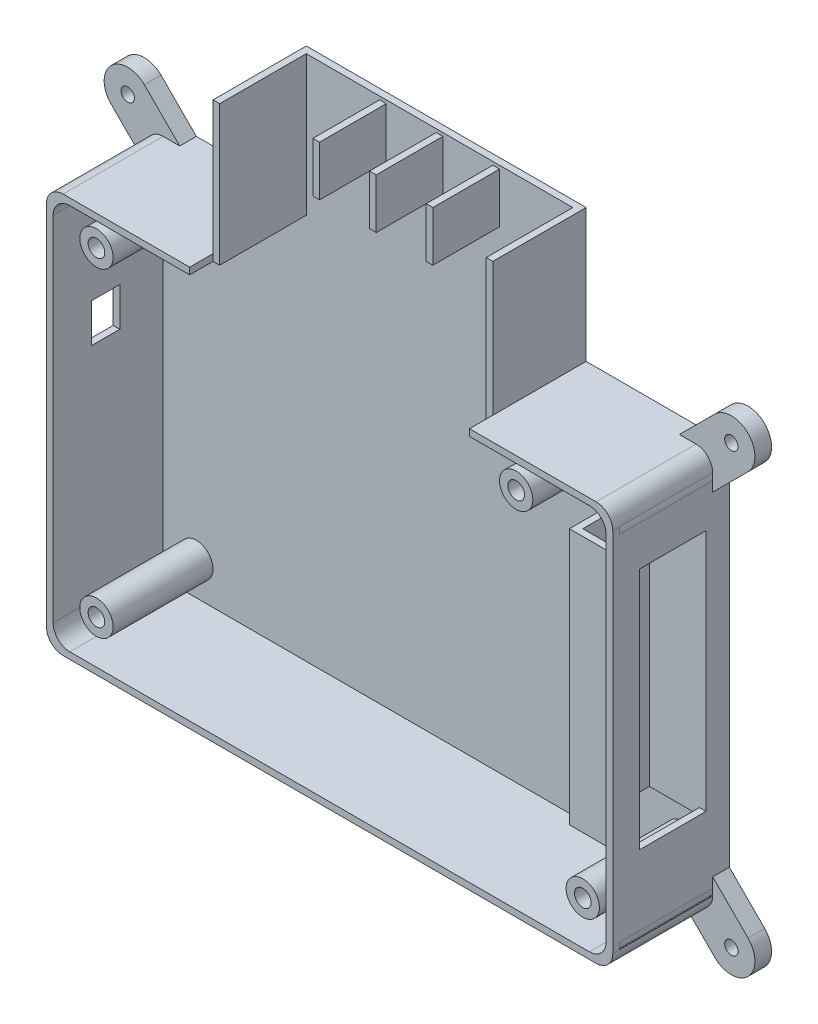
from build123d import *

# Parameters (mm, degrees)
SKETCH1_W                      = 170
SKETCH1_H                      = 120
BOSS_EXTRUDE1_DEPTH            = 35
SHELL1_T                       = -2
SKETCH2_R                      = 2
BOSS_EXTRUDE2_DEPTH            = 5
BOSS_EXTRUDE2_2_DEPTH          = 5
BOSS_EXTRUDE2_3_DEPTH          = 5
BOSS_EXTRUDE2_4_DEPTH          = 5
SKETCH3_W                      = 8.5
SKETCH3_H                      = 11.65
CUT_EXTRUDE1_DEPTH             = 168
SKETCH4_W                      = 84
SKETCH4_H                      = 33
CUT_EXTRUDE2_DEPTH             = 118
FILLET1_R                      = 5
FILLET2_R                      = 5
SKETCH5_W                      = 84
SKETCH5_H                      = 40
BOSS_EXTRUDE3_DEPTH            = 2
FILLET3_R                      = 5
FILLET4_R                      = 5
FILLET5_R                      = 5
FILLET6_R                      = 5
SKETCH9_W                      = 2
SKETCH9_H                      = 15
BOSS_EXTRUDE4_DEPTH            = 20
SKETCH10_W                     = 2
SKETCH10_H                     = 42
BOSS_EXTRUDE5_DEPTH            = 26
SKETCH13_W                     = 24
SKETCH13_H                     = 77
BOSS_EXTRUDE7_DEPTH            = 17
SHELL2_START                   = 7
SHELL2_OUTLINE_W               = 17
SHELL2_OUTLINE_H               = 73
SHELL2_DEPTH                   = 20
SHELL2_START_2                 = 2
SHELL2_2_DEPTH                 = 31
SKETCH14_W                     = 15
SKETCH14_H                     = 20
CUT_EXTRUDE4_DEPTH             = 5
SKETCH15_W                     = 15
SKETCH15_H                     = 20
CUT_EXTRUDE5_DEPTH             = 5
SKETCH21_R                     = 5
BOSS_EXTRUDE8_DEPTH            = 30
F_5_0MM_DOWEL_HOLE2_AT_2_COUNT = 2
F_5_0MM_DOWEL_HOLE2_AT_2_PITCH = 158.404545389


# Read off the part's stored shape, not the designer's step: Shell2
with BuildPart() as part:
    # Sketch1 → Boss-Extrude1 (new body)
    with BuildSketch(Plane.XY):
        with Locations((85, 60)):
            Rectangle(SKETCH1_W, SKETCH1_H)
    extrude(amount=BOSS_EXTRUDE1_DEPTH)

    # Shell1
    shell1_openings = [part.faces().sort_by_distance(p)[0] for p in [
        (85, 60, 35),
    ]]
    offset(amount=SHELL1_T, openings=shell1_openings, kind=Kind.INTERSECTION)

    # Sketch3 → Cut-Extrude1 (cut)
    with BuildSketch(Plane.ZY):
        with Locations((19.25, 79.175)):
            Rectangle(SKETCH3_W, SKETCH3_H)
    extrude(amount=-CUT_EXTRUDE1_DEPTH, mode=Mode.SUBTRACT)

    # Sketch4 → Cut-Extrude2 (cut)
    with BuildSketch(Plane(origin=(0, 120, 0), x_dir=(1, 0, 0), z_dir=(0, 1, 0))):
        with Locations((85, -18.5)):
            Rectangle(SKETCH4_W, SKETCH4_H)
    extrude(amount=-CUT_EXTRUDE2_DEPTH, mode=Mode.SUBTRACT)

    # Fillet1
    fillet1_edges = [part.edges().sort_by_distance(p)[0] for p in [
        (0, 120, 17.5),
        (170, 120, 17.5),
        (170, 0, 17.5),
        (0, 0, 17.5),
    ]]
    fillet(fillet1_edges, radius=FILLET1_R)

    # Fillet2
    fillet2_edges = [part.edges().sort_by_distance(p)[0] for p in [
        (2, 118, 18.5),
        (2, 2, 18.5),
        (168, 2, 18.5),
        (168, 118, 18.5),
    ]]
    fillet(fillet2_edges, radius=FILLET2_R)

    # Sketch5 → Boss-Extrude3 (add)
    with BuildSketch(Plane(origin=(0, 0, 0), x_dir=(-1, 0, 0), z_dir=(0, 0, -1))):
        with Locations((-85, 140)):
            Rectangle(SKETCH5_W, SKETCH5_H)
    extrude(amount=-BOSS_EXTRUDE3_DEPTH)

    # Sketch9 → Boss-Extrude4 (add)
    with BuildSketch(Plane.XY.offset(2)):
        with Locations((68, 151.5)):
            Rectangle(SKETCH9_W, SKETCH9_H)
        with Locations((85, 151.5)):
            Rectangle(SKETCH9_W, SKETCH9_H)
        with Locations((102, 151.5)):
            Rectangle(SKETCH9_W, SKETCH9_H)
    extrude(amount=BOSS_EXTRUDE4_DEPTH)

    # Sketch10 → Boss-Extrude5 (add)
    with BuildSketch(Plane.XY.offset(2)):
        with Locations((44, 139)):
            Rectangle(SKETCH10_W, SKETCH10_H)
        with Locations((126, 139)):
            Rectangle(SKETCH10_W, SKETCH10_H)
    extrude(amount=BOSS_EXTRUDE5_DEPTH)

    # Sketch13 → Boss-Extrude7 (add)
    with BuildSketch(Plane.ZY.offset(-168)):
        with Locations((17, 64.5)):
            Rectangle(SKETCH13_W, SKETCH13_H)
    extrude(amount=BOSS_EXTRUDE7_DEPTH)

    # Shell2 outline → Shell2 (cut)
    with BuildSketch(Plane.XY.offset(SHELL2_START)):
        with Locations((161.5, 64.5)):
            Rectangle(SHELL2_OUTLINE_W, SHELL2_OUTLINE_H)
        with BuildLine():
            ThreePointArc((169.708203932, 115), (169.926666858, 114.010587075), (170, 113))
            Line((170, 113), (170, 115))
            Line((170, 115), (169.708203932, 115))
        make_face()
        with BuildLine():
            Line((170, 5), (170, 7))
            ThreePointArc((170, 7), (169.926666858, 5.989412925), (169.708203932, 5))
            Line((169.708203932, 5), (170, 5))
        make_face()
    extrude(amount=SHELL2_DEPTH, mode=Mode.SUBTRACT)

    # Shell2 2 outline → Shell2 2 (cut)
    with BuildSketch(Plane.XY.offset(SHELL2_START_2)):
        with BuildLine():
            ThreePointArc((169.708203932, 115), (169.926666858, 114.010587075), (170, 113))
            Line((170, 113), (170, 115))
            Line((170, 115), (169.708203932, 115))
        make_face()
        with BuildLine():
            Line((170, 5), (170, 7))
            ThreePointArc((170, 7), (169.926666858, 5.989412925), (169.708203932, 5))
            Line((169.708203932, 5), (170, 5))
        make_face()
    extrude(amount=SHELL2_2_DEPTH, mode=Mode.SUBTRACT)

    # Sketch14 → Cut-Extrude4 (cut)
    with BuildSketch(Plane.XZ.offset(-101)):
        with Locations((160.5, 17)):
            Rectangle(SKETCH14_W, SKETCH14_H)
    extrude(amount=-CUT_EXTRUDE4_DEPTH, mode=Mode.SUBTRACT)

    # Sketch15 → Cut-Extrude5 (cut)
    with BuildSketch(Plane(origin=(0, 28, 0), x_dir=(1, 0, 0), z_dir=(0, 1, 0))):
        with Locations((160.5, -17)):
            Rectangle(SKETCH15_W, SKETCH15_H)
    extrude(amount=-CUT_EXTRUDE5_DEPTH, mode=Mode.SUBTRACT)


with BuildPart() as body_2:
    # Sketch2 → Boss-Extrude2 (new body)
    with BuildSketch(Plane(origin=(0, 0, 0), x_dir=(-1, 0, 0), z_dir=(0, 0, -1))):
        with BuildLine():
            Line((-160, 120), (-170.606601718, 130.606601718))
            ThreePointArc((-170.606601718, 130.606601718), (-180.606601718, 130.606601718), (-180.606601718, 120.606601718))
            Line((-180.606601718, 120.606601718), (-170, 110))
            Line((-170, 110), (-170, 120))
            Line((-170, 120), (-160, 120))
        make_face()
        with Locations((-175.606601718, 125.606601718)):
            Circle(SKETCH2_R, mode=Mode.SUBTRACT)
    extrude(amount=-BOSS_EXTRUDE2_DEPTH)

    # Fillet3
    fillet3_edges = [body_2.edges().sort_by_distance(p)[0] for p in [
        (170, 120, 2.5),
    ]]
    fillet(fillet3_edges, radius=FILLET3_R)


with BuildPart() as body_3:
    # Sketch2 → Boss-Extrude2 2 (new body)
    with BuildSketch(Plane(origin=(0, 0, 0), x_dir=(-1, 0, 0), z_dir=(0, 0, -1))):
        with BuildLine():
            Line((0, 110), (10.606601718, 120.606601718))
            ThreePointArc((10.606601718, 120.606601718), (10.606601718, 130.606601718), (0.606601718, 130.606601718))
            Line((0.606601718, 130.606601718), (-10, 120))
            Line((-10, 120), (0, 120))
            Line((0, 120), (0, 110))
        make_face()
        with Locations(Location((5.606601718, 125.606601718, 0), (0, 0, 180))):
            Circle(SKETCH2_R, mode=Mode.SUBTRACT)
    extrude(amount=-BOSS_EXTRUDE2_2_DEPTH)

    # Fillet4
    fillet4_edges = [body_3.edges().sort_by_distance(p)[0] for p in [
        (0, 120, 2.5),
    ]]
    fillet(fillet4_edges, radius=FILLET4_R)


    add(part.part)  # Boss-Extrude8 merges part


with BuildPart() as body_4:
    # Sketch2 → Boss-Extrude2 3 (new body)
    with BuildSketch(Plane(origin=(0, 0, 0), x_dir=(-1, 0, 0), z_dir=(0, 0, -1))):
        with BuildLine():
            Line((-10, 0), (0.606601718, -10.606601718))
            ThreePointArc((0.606601718, -10.606601718), (10.606601718, -10.606601718), (10.606601718, -0.606601718))
            Line((10.606601718, -0.606601718), (0, 10))
            Line((0, 10), (0, 0))
            Line((0, 0), (-10, 0))
        make_face()
        with Locations((5.606601718, -5.606601718)):
            Circle(SKETCH2_R, mode=Mode.SUBTRACT)
    extrude(amount=-BOSS_EXTRUDE2_3_DEPTH)

    # Fillet5
    fillet5_edges = [body_4.edges().sort_by_distance(p)[0] for p in [
        (0, 0, 2.5),
    ]]
    fillet(fillet5_edges, radius=FILLET5_R)


with BuildPart() as body_5:
    # Sketch2 → Boss-Extrude2 4 (new body)
    with BuildSketch(Plane(origin=(0, 0, 0), x_dir=(-1, 0, 0), z_dir=(0, 0, -1))):
        with BuildLine():
            Line((-170, 10), (-180.606601718, -0.606601718))
            ThreePointArc((-180.606601718, -0.606601718), (-180.606601718, -10.606601718), (-170.606601718, -10.606601718))
            Line((-170.606601718, -10.606601718), (-160, 0))
            Line((-160, 0), (-170, 0))
            Line((-170, 0), (-170, 10))
        make_face()
        with Locations(Location((-175.606601718, -5.606601718, 0), (0, 0, 180))):
            Circle(SKETCH2_R, mode=Mode.SUBTRACT)
    extrude(amount=-BOSS_EXTRUDE2_4_DEPTH)

    # Fillet6
    fillet6_edges = [body_5.edges().sort_by_distance(p)[0] for p in [
        (170, 0, 2.5),
    ]]
    fillet(fillet6_edges, radius=FILLET6_R)


with BuildPart() as body_3_1:
    add(body_3.part)

    add(body_4.part)  # Boss-Extrude8 merges body 4

    add(body_5.part)  # Boss-Extrude8 merges body 5
    # Sketch21 → Boss-Extrude8 (add)
    with BuildSketch(Plane.XY.offset(2)):
        with Locations(Location((12, 108, 0), (0, 0, 180))):
            Circle(SKETCH21_R)
        with Locations(Location((138, 108, 0), (0, 0, 180))):
            Circle(SKETCH21_R)
        with Locations(Location((12, 12, 0), (0, 0, 180))):
            Circle(SKETCH21_R)
        with Locations(Location((158, 12, 0), (0, 0, 180))):
            Circle(SKETCH21_R)
    extrude(amount=BOSS_EXTRUDE8_DEPTH)

    # Sketch28 → Ø5.0mm Dowel Hole2 (revolve, cut)
    with BuildSketch(Plane(origin=(138, 108, 32), x_dir=(0, -1, 0), z_dir=(1, 0, 0))):
        Polygon((0, 0), (0, 6.502151548), (2.5, 5), (2.5, 0), align=None)
    f_5_0mm_dowel_hole2 = revolve(axis=Axis((138, 108, 38.35), (0, 0, -1)), mode=Mode.SUBTRACT)

    # Ø5.0mm Dowel Hole2 at 2: Ø5.0mm Dowel Hole2 ×2
    with Locations(*[Vector(-0.7954317200324987, -0.6060432152628561, 0) * (i * F_5_0MM_DOWEL_HOLE2_AT_2_PITCH) for i in range(1, F_5_0MM_DOWEL_HOLE2_AT_2_COUNT)]):
        add(f_5_0mm_dowel_hole2, mode=Mode.SUBTRACT)

    # Sketch30 → Ø5.0mm Dowel Hole4 (revolve, cut)
    with BuildSketch(Plane(origin=(12, 108, 32), x_dir=(0, -1, 0), z_dir=(1, 0, 0))):
        Polygon((0, 0), (0, 6.502151548), (2.5, 5), (2.5, 0), align=None)
    revolve(axis=Axis((12, 108, 38.35), (0, 0, -1)), mode=Mode.SUBTRACT)

    # Sketch31 → Ø5.0mm Dowel Hole5 (revolve, cut)
    with BuildSketch(Plane(origin=(158, 12, 32), x_dir=(0, -1, 0), z_dir=(1, 0, 0))):
        Polygon((0, 0), (0, 6.502151548), (2.5, 5), (2.5, 0), align=None)
    revolve(axis=Axis((158, 12, 38.35), (0, 0, -1)), mode=Mode.SUBTRACT)


solid = Compound([body_2.part, body_3_1.part])
